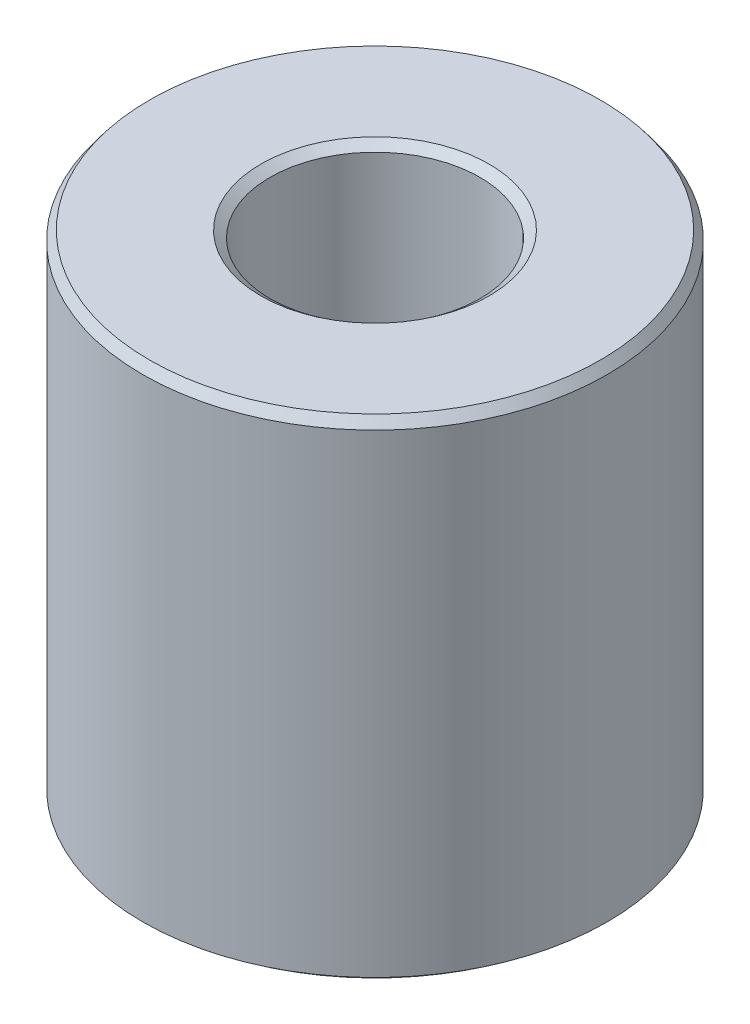
from build123d import *
from OCP.BRepFilletAPI import BRepFilletAPI_MakeChamfer

# Parameters (mm, degrees)
SKETCH1_R           = 57.5
BOSS_EXTRUDE1_DEPTH = 121.314895808
SKETCH2_R           = 26.010297742
CUT_EXTRUDE1_DEPTH  = 147.047266133
CHAMFER1_SIZE       = 2.258726359
CHAMFER1_SIZE2      = 1.71021884


with BuildPart() as part:
    # Sketch1 → Boss-Extrude1 (new body)
    with BuildSketch(Plane(origin=(0, 0, 0), x_dir=(1, 0, 0), z_dir=(0, 1, 0))):
        Circle(SKETCH1_R)
    extrude(amount=BOSS_EXTRUDE1_DEPTH)

    # Sketch2 → Cut-Extrude1 (cut, through all)
    with BuildSketch(Plane(origin=(0, 0, 0), x_dir=(1, 0, 0), z_dir=(0, 1, 0))):
        Circle(SKETCH2_R)
    extrude(amount=CUT_EXTRUDE1_DEPTH, mode=Mode.SUBTRACT)

    # Chamfer1: one chamfer whose edges measure the first distance from different faces: ONE call of the kernel's chamfer builder (chamfer() names one face for all edges)
    chamfer1_edges_1 = [part.edges().sort_by_distance(p)[0] for p in [
        (-26.010297742, 121.314895808, 0),
    ]]
    chamfer1_side_1 = [part.faces().sort_by_distance(p)[0] for p in [
        (-55.873654403, 121.314895808, 0),
    ]]
    chamfer1_edges_2 = [part.edges().sort_by_distance(p)[0] for p in [
        (-26.010297742, 0, 0),
    ]]
    chamfer1_side_2 = [part.faces().sort_by_distance(p)[0] for p in [
        (-26.010297742, 60.657447904, 0),
    ]]
    chamfer1_edges_3 = [part.edges().sort_by_distance(p)[0] for p in [
        (-57.5, 0, 0),
    ]]
    chamfer1_side_3 = [part.faces().sort_by_distance(p)[0] for p in [
        (-55.873654403, 0, 0),
    ]]
    chamfer1_edges_4 = [part.edges().sort_by_distance(p)[0] for p in [
        (-57.5, 121.314895808, 0),
    ]]
    chamfer1_side_4 = [part.faces().sort_by_distance(p)[0] for p in [
        (-57.5, 60.657447904, 0),
    ]]
    chamfer1 = BRepFilletAPI_MakeChamfer(part.part.solid().wrapped)
    for e in chamfer1_edges_1:
        chamfer1.Add(CHAMFER1_SIZE, CHAMFER1_SIZE2, e.wrapped, chamfer1_side_1[0].wrapped)  # the first distance lies on this face
    for e in chamfer1_edges_2:
        chamfer1.Add(CHAMFER1_SIZE, CHAMFER1_SIZE2, e.wrapped, chamfer1_side_2[0].wrapped)  # the first distance lies on this face
    for e in chamfer1_edges_3:
        chamfer1.Add(CHAMFER1_SIZE, CHAMFER1_SIZE2, e.wrapped, chamfer1_side_3[0].wrapped)  # the first distance lies on this face
    for e in chamfer1_edges_4:
        chamfer1.Add(CHAMFER1_SIZE, CHAMFER1_SIZE2, e.wrapped, chamfer1_side_4[0].wrapped)  # the first distance lies on this face
    add(Compound.cast(chamfer1.Shape()), mode=Mode.REPLACE)


solid = part.part
